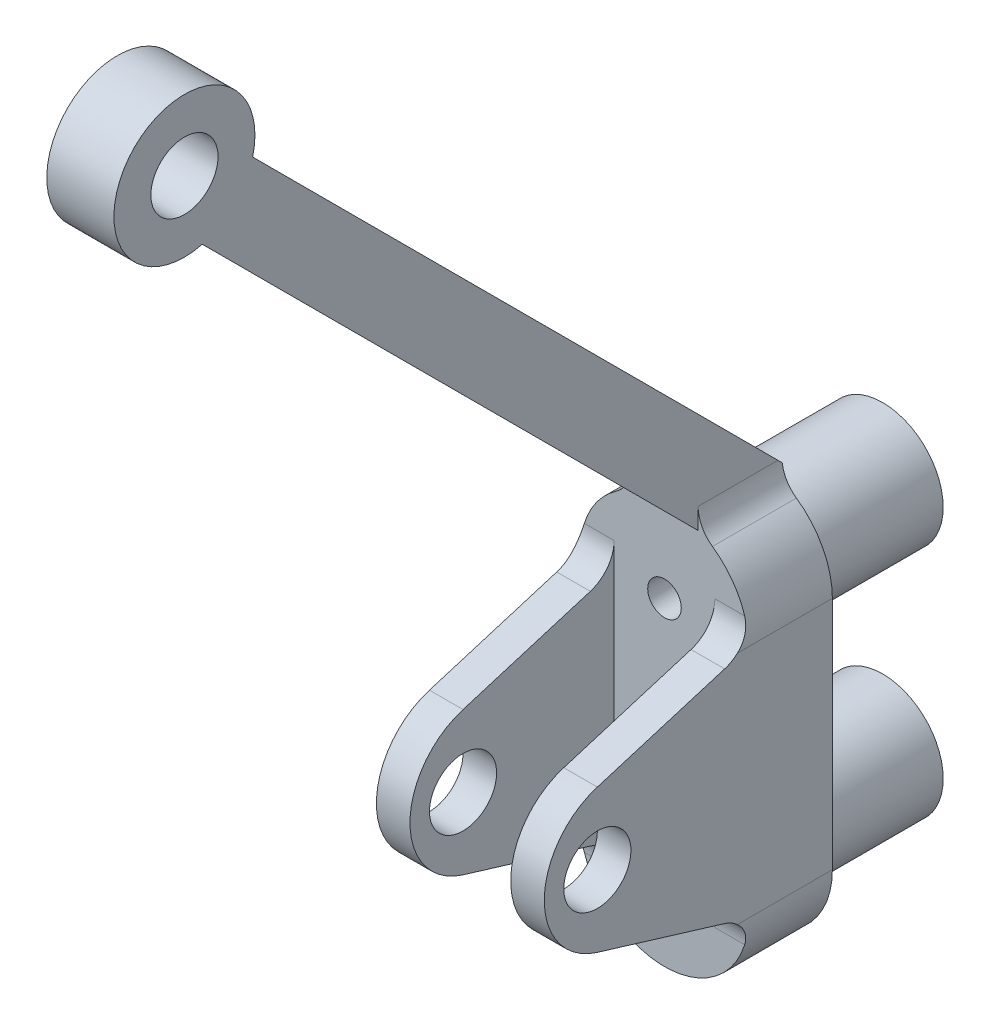
from build123d import *

# Parameters (mm, degrees)
SKETCH1_R                = 0.5
BOSS_EXTRUDE1_DEPTH      = 2.5
SKETCH2_R                = 1
BOSS_EXTRUDE2_DEPTH      = 1
FILLET1_R                = 1
BOSS_EXTRUDE4_DEPTH      = 1
BOSS_EXTRUDE4_DEPTH_BACK = 1
SKETCH3_R                = 1
FILLET2_R                = 1
BOSS_EXTRUDE5_START      = -2
SKETCH4_R                = 2.1
SKETCH4_R_2              = 1
BOSS_EXTRUDE5_DEPTH      = 2
BOSS_EXTRUDE6_START      = 4
SKETCH5_R                = 1.8
SKETCH5_R_2              = 0.5
BOSS_EXTRUDE6_DEPTH      = 4


with BuildPart() as part:
    # Sketch1 → Boss-Extrude1 (new body)
    with BuildSketch(Plane.XY):
        with BuildLine():
            Line((-2.5, -3.5), (-2.5, 3.5))
            ThreePointArc((-2.5, 3.5), (0, 6), (2.5, 3.5))
            Line((2.5, 3.5), (2.5, -3.5))
            ThreePointArc((2.5, -3.5), (0, -6), (-2.5, -3.5))
        make_face()
        with Locations((0, 3.5)):
            Circle(SKETCH1_R, mode=Mode.SUBTRACT)
        with Locations((0, -3.5)):
            Circle(SKETCH1_R, mode=Mode.SUBTRACT)
    extrude(amount=BOSS_EXTRUDE1_DEPTH)

    # Sketch2 → Boss-Extrude2 (add)
    with BuildSketch(Plane(origin=(2.5, 0, 0), x_dir=(0, 0, -1), z_dir=(1, 0, 0))):
        with BuildLine():
            Line((-7, 2.132114954), (-2.5, 3.5))
            Line((-2.5, 3.5), (-2.5, -3.5))
            Line((-2.5, -3.5), (-7, -2.132114954))
            ThreePointArc((-7, -2.132114954), (-8.580334649, 0), (-7, 2.132114954))
        make_face()
        with Locations(Location((-7, 0, 0), (0, 0, 90))):
            Circle(SKETCH2_R, mode=Mode.SUBTRACT)
    boss_extrude2 = extrude(amount=-BOSS_EXTRUDE2_DEPTH)

    # Mirror1: Boss-Extrude2 across plane
    add(boss_extrude2.mirror(Plane(origin=(0, 0, 0), x_dir=(0, 0, 1), z_dir=(1, 0, 0))))

    # Fillet1
    fillet1_edges = [part.edges().sort_by_distance(p)[0] for p in [
        (2, 3.5, 2.5),
        (2, -3.5, 2.5),
        (-2, -3.5, 2.5),
        (-2, 3.5, 2.5),
    ]]
    fillet(fillet1_edges, radius=FILLET1_R)

    # Sketch3 → Boss-Extrude4 (add, two sides: drawn at the far end of the back side and taken through both)
    with BuildSketch(Plane(origin=(0, 0, 0), x_dir=(0, 0, -1), z_dir=(1, 0, 0)).offset(-BOSS_EXTRUDE4_DEPTH_BACK)):
        with BuildLine():
            Line((-16.297863431, 22.547863431), (0, 6.25))
            Line((0, 6.25), (0, 5.75))
            Line((0, 5.75), (-2.5, 5.75))
            Line((-2.5, 5.75), (-17.797863431, 21.047863431))
            ThreePointArc((-17.797863431, 21.047863431), (-18.858523603, 23.608523603), (-16.297863431, 22.547863431))
        make_face()
        with Locations((-17.797863431, 22.547863431)):
            Circle(SKETCH3_R, mode=Mode.SUBTRACT)
    extrude(amount=BOSS_EXTRUDE4_DEPTH + BOSS_EXTRUDE4_DEPTH_BACK)

    # Fillet2
    # the kernel refuses this fillet: 1 mm, written as the material it adds along each edge
    with BuildSketch(Plane(origin=(-1, 5.791287847, 2.5), x_dir=(-0.8728024908483876, -0.4880735722909512, 0), z_dir=(0, 0, -1))) as fillet2_piece_1_section:
        with BuildLine():
            CenterArc((0.58923493, 0.995166125), FILLET2_R, 209.214041529, 55.150095421)
            Line((-0.283567561, 0.507092553), (0, 0))
            ThreePointArc((0, 0), (0.245514554, 0.012084687), (0.491029108, 0))
        make_face()
    fillet2_piece_1 = extrude(amount=2.5, mode=Mode.PRIVATE)
    fillet2_piece_1 = split(fillet2_piece_1, bisect_by=Plane(origin=(-1.294147524, 7.163115331, 0.913115331), z_dir=(0, -0.7071067811865476, 0.7071067811865476)), keep=Keep.TOP, mode=Mode.PRIVATE)
    add(fillet2_piece_1)
    with BuildSketch(Plane(origin=(1, 5.791287847, 2.5), x_dir=(0.8728024908483896, -0.4880735722909475, 0), z_dir=(0, 0, -1))) as fillet2_piece_2_section:
        with BuildLine():
            CenterArc((0.58923493, -0.995166125), FILLET2_R, 95.63586305, 55.150095421)
            Line((-0.283567561, -0.507092553), (0, 0))
            ThreePointArc((0, 0), (0.245514554, -0.012084687), (0.491029108, 0))
        make_face()
    fillet2_piece_2 = extrude(amount=2.5, mode=Mode.PRIVATE)
    fillet2_piece_2 = split(fillet2_piece_2, bisect_by=Plane(origin=(1.294147524, 7.163115331, 0.913115331), z_dir=(0, -0.7071067811865476, 0.7071067811865476)), keep=Keep.TOP, mode=Mode.PRIVATE)
    add(fillet2_piece_2)

    # Sketch4 → Boss-Extrude5 (add)
    with BuildSketch(Plane(origin=(1, 0, 0), x_dir=(0, 0, -1), z_dir=(1, 0, 0)).offset(BOSS_EXTRUDE5_START)):
        with Locations((-17.797863431, 22.547863431)):
            Circle(SKETCH4_R)
        with Locations((-17.797863431, 22.547863431)):
            Circle(SKETCH4_R_2, mode=Mode.SUBTRACT)
    extrude(amount=BOSS_EXTRUDE5_DEPTH)

    # Sketch5 → Boss-Extrude6 (add)
    # profile 1 of 2: a face of its own
    with BuildSketch(Plane(origin=(0, 0, 0), x_dir=(-1, 0, 0), z_dir=(0, 0, -1)).offset(BOSS_EXTRUDE6_START)):
        with Locations(Location((0, 3.5, 0), (0, 0, 180))):
            Circle(SKETCH5_R)
        with Locations((0, 3.5)):
            Circle(SKETCH5_R_2, mode=Mode.SUBTRACT)
    # profile 2 of 2: a face of its own
    with BuildSketch(Plane(origin=(0, 0, 0), x_dir=(-1, 0, 0), z_dir=(0, 0, -1)).offset(BOSS_EXTRUDE6_START)):
        with Locations(Location((0, -3.5, 0), (0, 0, 180))):
            Circle(SKETCH5_R)
        with Locations((0, -3.5)):
            Circle(SKETCH5_R_2, mode=Mode.SUBTRACT)
    extrude(amount=-BOSS_EXTRUDE6_DEPTH)


solid = part.part
